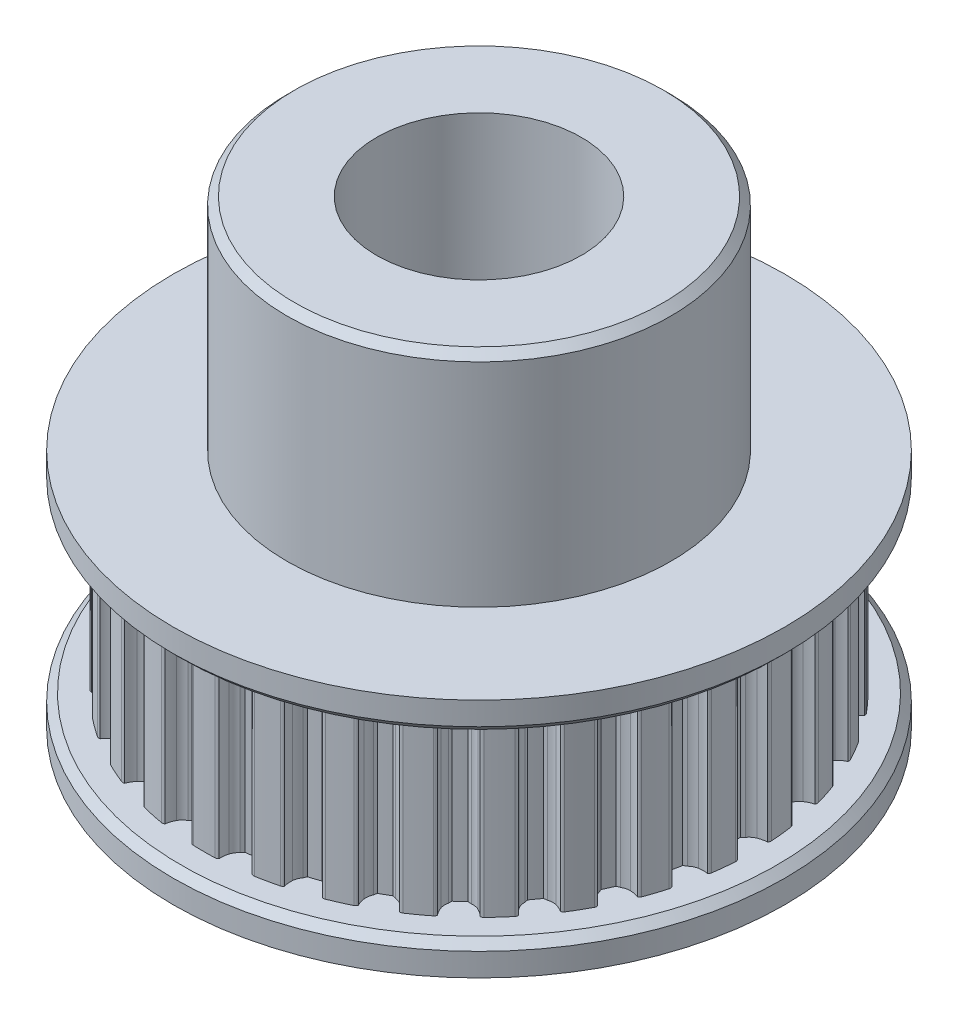
from build123d import *

# Parameters (mm, degrees)
BOSS_EXTRUDE1_DEPTH     = 7
SKETCH2_R               = 9.996
BOSS_EXTRUDE2_DEPTH     = 7
CIRPATTERN3_COUNT       = 30
SKETCH3_R               = 11.946
BOSS_EXTRUDE3_DEPTH     = 1.2
BOSS_EXTRUDE4_START     = 1.2
SKETCH4_R               = 11.946
BOSS_EXTRUDE4_DEPTH     = 1.2
SKETCH12_R              = 7.5
BOSS_EXTRUDE10_DEPTH    = 8.6
CUT_EXTRUDE1_DEPTH      = 20.333231287
CUT_EXTRUDE1_DEPTH_BACK = 20.333231287
SKETCH5_R               = 4
CHAMFER1_SIZE           = 0.3


with BuildPart() as part:
    # Sketch1 → Boss-Extrude1 (new body)
    with BuildSketch(Plane(origin=(0, 0, 0), x_dir=(1, 0, 0), z_dir=(0, 1, 0))):
        with BuildLine():
            ThreePointArc((0.826498814, 9.961772719), (0.780770063, 10.016376304), (0.739043842, 10.074096254))
            ThreePointArc((0.739043842, 10.074096254), (0.635968618, 10.193168964), (0.570490053, 10.336400838))
            ThreePointArc((0.570490053, 10.336400838), (0.535253256, 10.511107627), (0.53093728, 10.689280202))
            ThreePointArc((0.53093728, 10.689280202), (0.483560109, 10.723802473), (0.426569466, 10.737530186))
            ThreePointArc((0.426569466, 10.737530186), (0, 10.746), (-0.426569466, 10.737530186))
            ThreePointArc((-0.426569466, 10.737530186), (-0.483560109, 10.723802473), (-0.53093728, 10.689280202))
            ThreePointArc((-0.53093728, 10.689280202), (-0.535253256, 10.511107627), (-0.570490053, 10.336400838))
            ThreePointArc((-0.570490053, 10.336400838), (-0.635968618, 10.193168964), (-0.739043842, 10.074096254))
            ThreePointArc((-0.739043842, 10.074096254), (-0.780770063, 10.016376304), (-0.826498814, 9.961772719))
            ThreePointArc((-0.826498814, 9.961772719), (0, 9.996), (0.826498814, 9.961772719))
        make_face()
    boss_extrude1 = extrude(amount=BOSS_EXTRUDE1_DEPTH)

    # Sketch2 → Boss-Extrude2 (add)
    with BuildSketch(Plane.XZ):
        Circle(SKETCH2_R)
        with BuildLine():
            ThreePointArc((-0.739043842, -10.074096254), (-0.635968618, -10.193168964), (-0.570490053, -10.336400838))
            ThreePointArc((-0.570490053, -10.336400838), (-0.535253256, -10.511107627), (-0.53093728, -10.689280202))
            ThreePointArc((-0.53093728, -10.689280202), (-0.483560109, -10.723802473), (-0.426569466, -10.737530186))
            ThreePointArc((-0.426569466, -10.737530186), (0, -10.746), (0.426569466, -10.737530186))
            ThreePointArc((0.426569466, -10.737530186), (0.483560109, -10.723802473), (0.53093728, -10.689280202))
            ThreePointArc((0.53093728, -10.689280202), (0.535253256, -10.511107627), (0.570490053, -10.336400838))
            ThreePointArc((0.570490053, -10.336400838), (0.635968618, -10.193168964), (0.739043842, -10.074096254))
            ThreePointArc((0.739043842, -10.074096254), (0.780770063, -10.016376304), (0.826498814, -9.961772719))
            ThreePointArc((0.826498814, -9.961772719), (0, -9.996), (-0.826498814, -9.961772719))
            ThreePointArc((-0.826498814, -9.961772719), (-0.780770063, -10.016376304), (-0.739043842, -10.074096254))
        make_face()
    extrude(amount=-BOSS_EXTRUDE2_DEPTH)

    # CirPattern3: Boss-Extrude1 ×30 about axis
    cirpattern3_axis = Axis((0, 0, 0), (0, 1, 0))
    for i in range(1, CIRPATTERN3_COUNT):
        add(boss_extrude1.rotate(cirpattern3_axis, i * 360 / CIRPATTERN3_COUNT))

    # Sketch3 → Boss-Extrude3 (add)
    with BuildSketch(Plane(origin=(0, 7, 0), x_dir=(1, 0, 0), z_dir=(0, 1, 0))):
        with Locations(Location((0, 0, 0), (0, 0, 270))):
            Circle(SKETCH3_R)
    extrude(amount=BOSS_EXTRUDE3_DEPTH)

    # Sketch4 → Boss-Extrude4 (add)
    with BuildSketch(Plane.XZ.offset(BOSS_EXTRUDE4_START)):
        with Locations(Location((0, 0, 0), (0, 0, 90))):
            Circle(SKETCH4_R)
    extrude(amount=-BOSS_EXTRUDE4_DEPTH)

    # Sketch12 → Boss-Extrude10 (add)
    with BuildSketch(Plane(origin=(0, 8.2, 0), x_dir=(1, 0, 0), z_dir=(0, 1, 0))):
        with Locations(Location((0, 0, 0), (0, 0, 90))):
            Circle(SKETCH12_R)
    extrude(amount=BOSS_EXTRUDE10_DEPTH)

    # Sketch5 → Cut-Extrude1 (cut, two sides: drawn at the far end of the back side and taken through both)
    with BuildSketch(Plane(origin=(0, 8.2, 0), x_dir=(1, 0, 0), z_dir=(0, 1, 0)).offset(-CUT_EXTRUDE1_DEPTH_BACK)):
        with Locations(Location((0, 0, 0), (0, 0, 270))):
            Circle(SKETCH5_R)
    extrude(amount=CUT_EXTRUDE1_DEPTH + CUT_EXTRUDE1_DEPTH_BACK, mode=Mode.SUBTRACT)

    # Chamfer1
    chamfer1_edges = [part.edges().sort_by_distance(p)[0] for p in [
        (0, 16.8, 7.5),
        (0, 7, -11.946),
        (0, 0, -11.946),
    ]]
    chamfer(chamfer1_edges, length=CHAMFER1_SIZE)


solid = part.part
